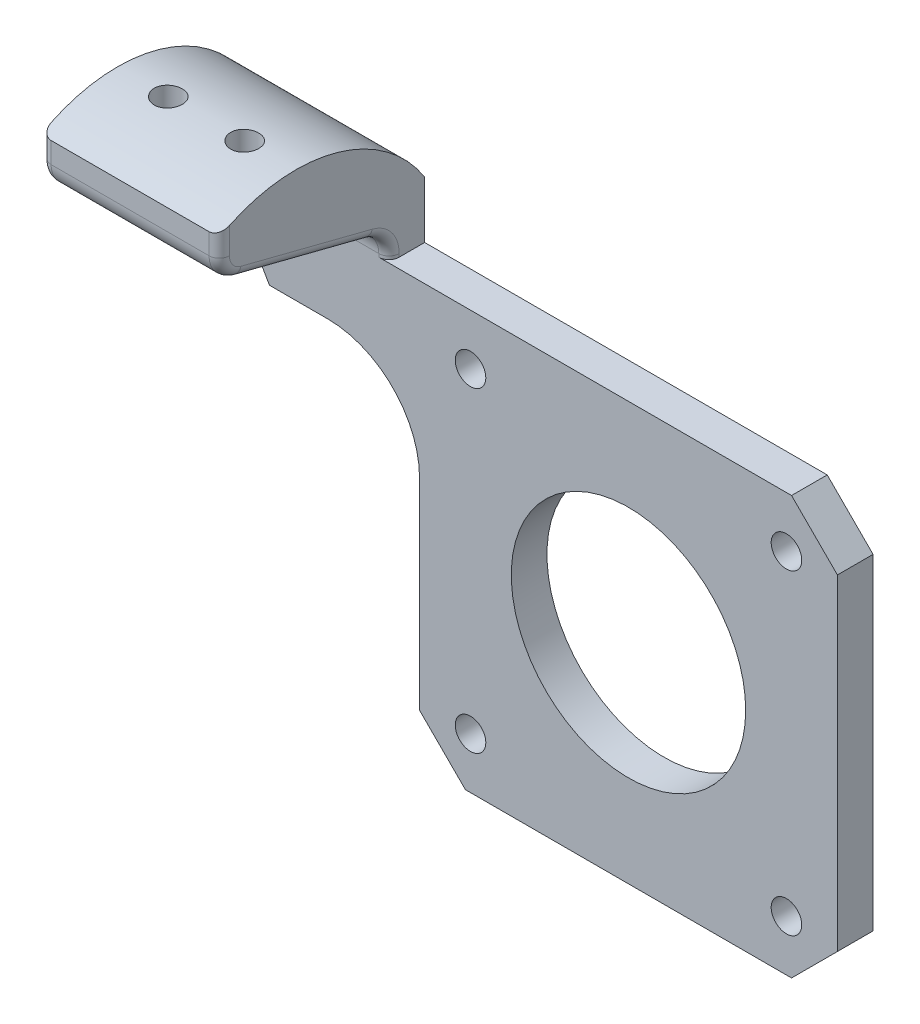
from build123d import *

# Parameters (mm, degrees)
SKETCH1_R           = 11.5
SKETCH1_R_2         = 1.4999999999999991
SKETCH1_R_3         = 1.4999999999999987
SKETCH1_R_4         = 1.5000000000000009
SKETCH1_R_5         = 1.5000000000000002
BOSS_EXTRUDE1_DEPTH = 3.5
BOSS_EXTRUDE2_DEPTH = 17.5
CUT_EXTRUDE1_DEPTH  = 73.64483808227534
SKETCH4_R           = 1.3750000000000042
SKETCH4_R_2         = 1.375000000000001
CUT_EXTRUDE2_DEPTH  = 266.22147666332955
FILLET1_R           = 2.5
FILLET2_R           = 1


with BuildPart() as part:
    # Sketch1 → Boss-Extrude1 (new body)
    with BuildSketch(Plane.XY):
        with BuildLine():
            Line((-20.5, -16.000000000000007), (-15.999999999999996, -20.500000000000007))
            Line((-15.999999999999996, -20.500000000000007), (16.000000000000004, -20.5))
            Line((16.000000000000004, -20.5), (20.5, -16))
            Line((20.5, -16), (20.5, 16))
            Line((20.5, 16), (16.000000000000004, 20.5))
            Line((16.000000000000004, 20.5), (-23.500000000000007, 20.5))
            Line((-23.500000000000007, 20.5), (-23.500000000000007, 33))
            Line((-23.500000000000007, 33), (-41.00000000000001, 33))
            Line((-41.00000000000001, 33), (-41.00000000000001, 22.75))
            Line((-41.00000000000001, 22.75), (-35.22649730810378, 12.75))
            Line((-35.22649730810378, 12.75), (-29.500000000000007, 12.750000000000002))
            ThreePointArc((-29.500000000000007, 12.750000000000002), (-23.136038969321078, 10.11396103067893), (-20.500000000000004, 3.750000000000001))
            Line((-20.500000000000004, 3.750000000000001), (-20.5, -16.000000000000007))
        make_face()
        Circle(SKETCH1_R, mode=Mode.SUBTRACT)
        with Locations((-15.500000000000002, 15.5)):
            Circle(SKETCH1_R_2, mode=Mode.SUBTRACT)
        with Locations((15.500000000000002, 15.499999999999998)):
            Circle(SKETCH1_R_3, mode=Mode.SUBTRACT)
        with Locations((15.5, -15.5)):
            Circle(SKETCH1_R_4, mode=Mode.SUBTRACT)
        with Locations((-15.5, -15.5)):
            Circle(SKETCH1_R_5, mode=Mode.SUBTRACT)
        with Locations((-30.00000000000001, 20.746197723675813)):
            Circle(SKETCH1_R_4, mode=Mode.SUBTRACT)
    extrude(amount=BOSS_EXTRUDE1_DEPTH)

    # Sketch2 → Boss-Extrude2 (add)
    with BuildSketch(Plane.ZY.offset(41.00000000000001)):
        Polygon((3.5, 33), (20.15, 33), (20.15, 27.000000000000004), (3.5, 22.75), align=None)
    extrude(amount=-BOSS_EXTRUDE2_DEPTH)

    # Sketch3 → Cut-Extrude1 (cut, through all)
    with BuildSketch(Plane.ZY.offset(41.00000000000001)):
        with BuildLine():
            Line((0, 26.060862236758553), (0, 38.04576260464925))
            Line((0, 38.04576260464925), (20.15, 38.04576260464925))
            Line((20.15, 38.04576260464925), (20.149999999999995, 30.990381056766584))
            ThreePointArc((20.149999999999995, 30.990381056766584), (9.085499481104915, 32.57032381420525), (0, 26.060862236758553))
        make_face()
    extrude(amount=-CUT_EXTRUDE1_DEPTH, mode=Mode.SUBTRACT)

    # Sketch4 → Cut-Extrude2 (cut, through all)
    with BuildSketch(Plane(origin=(-1.4737e-13, -20.499999999999993, -236.3635116976825), x_dir=(1, 2.2e-16, 0), z_dir=(-2.2e-16, 1, 0))):
        with Locations((-35.99999999999985, -249.01351169768247)):
            Circle(SKETCH4_R)
        with Locations((-28.499999999999844, -249.01351169768247)):
            Circle(SKETCH4_R_2)
    extrude(amount=CUT_EXTRUDE2_DEPTH, mode=Mode.SUBTRACT)

    # Fillet1
    # the kernel refuses this fillet: 2.5 mm, written as the material it adds along each edge
    with BuildSketch(Plane(origin=(-41.00000000000001, 22.75, 3.5), x_dir=(0, -1, 0), z_dir=(1, 0, 0))) as fillet1_piece_1_section:
        with BuildLine():
            CenterArc((FILLET1_R * 0.776808330642, -FILLET1_R), FILLET1_R, 90, 75.68071687498136)
            Line((-FILLET1_R * 0.192124217376, -FILLET1_R * 0.752674875131), (0, 0))
            Line((0, 0), (FILLET1_R * 0.776808330642, 0))
        make_face()
    fillet1_piece_1 = extrude(amount=17.5, mode=Mode.PRIVATE)
    fillet1_piece_1 = split(fillet1_piece_1, bisect_by=Plane(origin=(-38.678687412646255, 18.729368658454117, 3.931557915234251), z_dir=(0.8660254037844398, 0.49999999999999795, 0)), keep=Keep.TOP, mode=Mode.PRIVATE)
    fillet1_piece_1 = fillet1_piece_1 - Plane(origin=(-30.00000000000001, 20.746197723675813, 3.931557915234251), x_dir=(1, 0, 0), z_dir=(0, 0, -1)) * Cylinder(1.5000000000000009, 43, mode=Mode.PRIVATE)
    add(fillet1_piece_1)
    # the kernel refuses this fillet: 2.5 mm, written as the material it takes off along each edge
    with BuildSketch(Plane(origin=(-45.855052066513494, 27.000000000000004, 20.15), x_dir=(0, 1, 0), z_dir=(1, 0, 0))) as fillet1_2_piece_1:
        with BuildLine():
            CenterArc((FILLET1_R * 0.776808330642, -FILLET1_R), FILLET1_R, 90, 75.68071687498119)
            Line((-FILLET1_R * 0.192124217376, -FILLET1_R * 0.752674875131), (0, 0))
            Line((0, 0), (FILLET1_R * 0.776808330642, 0))
        make_face()
    extrude(amount=27.21010413302697, mode=Mode.SUBTRACT)

    # Fillet2
    fillet2_edges = [part.edges().sort_by_distance(p)[0] for p in [
        (-41.00000000000001, 24.875, 11.825),
        (-23.500000000000007, 24.875, 11.825),
        (-41.00000000000001, 29.96620094168579, 20.15),
        (-41, 27.408362134202072, 19.624307730627862),
        (-23.500000000000007, 29.96620094168579, 20.15),
        (-23.5, 27.408362134202072, 19.624307730627862),
        (-41, 23.04189744334401, 4.877676890023187),
        (-23.5, 22.341637865797928, 4.025692269372136),
        (-41, 22.749999999999133, 2.2128286226876686),
        (-23.500000000000007, 20.6539895866975, 3.5),
    ]]
    fillet(fillet2_edges, radius=FILLET2_R)


solid = part.part
